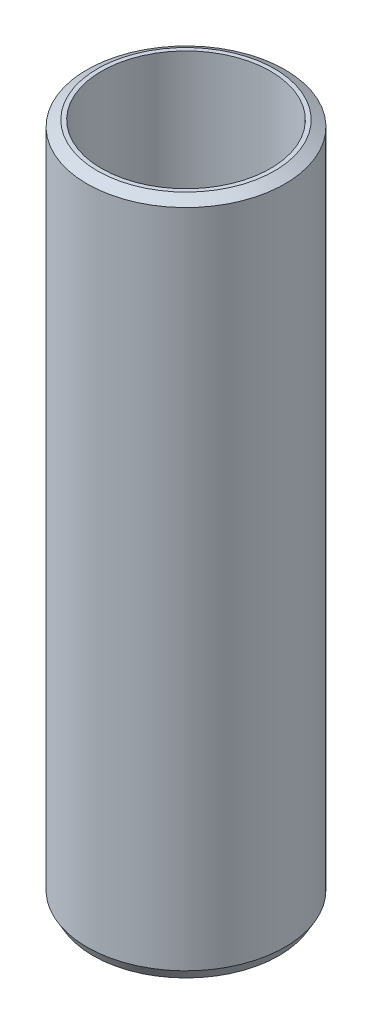
from build123d import *
from OCP.BRepFilletAPI import BRepFilletAPI_MakeChamfer

# Parameters (mm, degrees)
SKETCH1_R           = 55
BOSS_EXTRUDE1_DEPTH = 376.475175347
SKETCH2_R           = 46.910707881
CUT_EXTRUDE1_DEPTH  = 385.426270762
CHAMFER1_SIZE       = 3.346450575
CHAMFER1_SIZE2      = 5.796222421


with BuildPart() as part:
    # Sketch1 → Boss-Extrude1 (new body)
    with BuildSketch(Plane(origin=(0, 0, 0), x_dir=(1, 0, 0), z_dir=(0, 1, 0))):
        Circle(SKETCH1_R)
    extrude(amount=BOSS_EXTRUDE1_DEPTH)

    # Sketch2 → Cut-Extrude1 (cut, through all)
    with BuildSketch(Plane(origin=(0, 0, 0), x_dir=(1, 0, 0), z_dir=(0, 1, 0))):
        Circle(SKETCH2_R)
    extrude(amount=CUT_EXTRUDE1_DEPTH, mode=Mode.SUBTRACT)

    # Chamfer1: one chamfer whose edges measure the first distance from different faces: ONE call of the kernel's chamfer builder (chamfer() names one face for all edges)
    chamfer1_edges_1 = [part.edges().sort_by_distance(p)[0] for p in [
        (-55, 376.475175347, 0),
    ]]
    chamfer1_side_1 = [part.faces().sort_by_distance(p)[0] for p in [
        (-55, 188.237587673, 0),
    ]]
    chamfer1_edges_2 = [part.edges().sort_by_distance(p)[0] for p in [
        (-55, 0, 0),
    ]]
    chamfer1_side_2 = [part.faces().sort_by_distance(p)[0] for p in [
        (-53.444365081, 0, 0),
    ]]
    chamfer1 = BRepFilletAPI_MakeChamfer(part.part.solid().wrapped)
    for e in chamfer1_edges_1:
        chamfer1.Add(CHAMFER1_SIZE, CHAMFER1_SIZE2, e.wrapped, chamfer1_side_1[0].wrapped)  # the first distance lies on this face
    for e in chamfer1_edges_2:
        chamfer1.Add(CHAMFER1_SIZE, CHAMFER1_SIZE2, e.wrapped, chamfer1_side_2[0].wrapped)  # the first distance lies on this face
    add(Compound.cast(chamfer1.Shape()), mode=Mode.REPLACE)


solid = part.part
